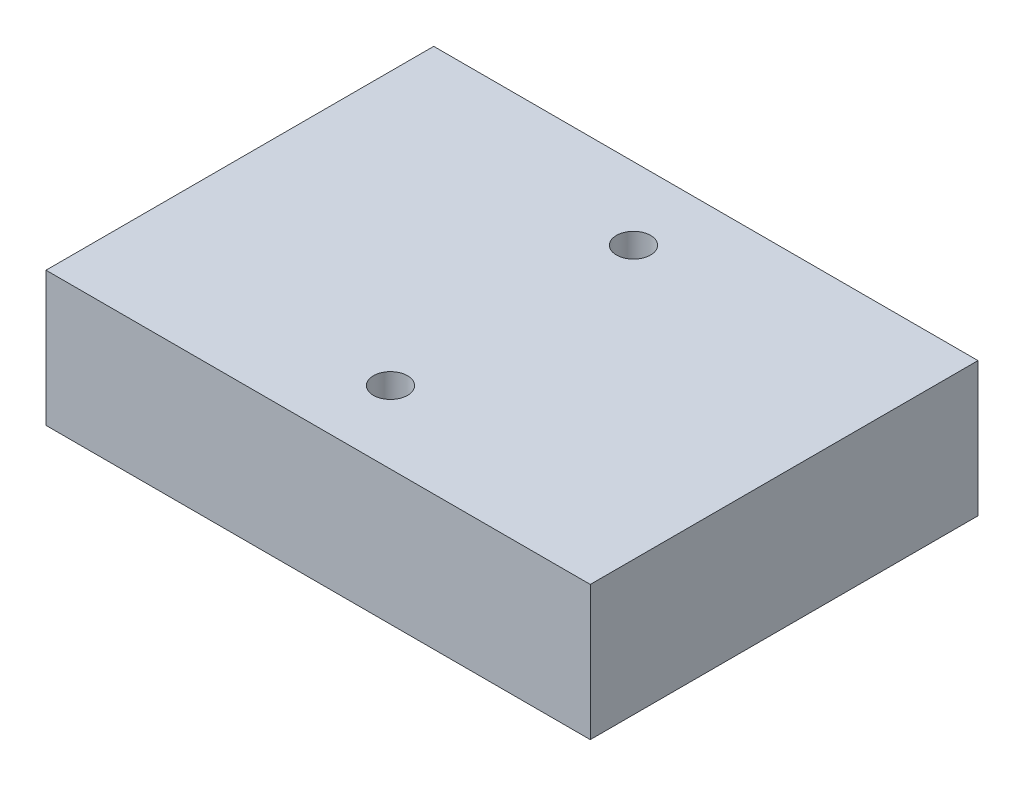
from build123d import *

# Parameters (mm, degrees)
SKETCH1_W           = 52.63
SKETCH1_H           = 37.49
BOSS_EXTRUDE1_DEPTH = 13
SKETCH2_R           = 1.65
CUT_EXTRUDE1_DEPTH  = 35.826057055


with BuildPart() as part:
    # Sketch1 → Boss-Extrude1 (new body)
    with BuildSketch(Plane(origin=(0, 0, 0), x_dir=(1, 0, 0), z_dir=(0, 1, 0))):
        Rectangle(SKETCH1_W, SKETCH1_H)
    extrude(amount=BOSS_EXTRUDE1_DEPTH)

    # Sketch2 → Cut-Extrude1 (cut, through all)
    with BuildSketch(Plane(origin=(0, 13, 0), x_dir=(1, 0, 0), z_dir=(0, 1, 0))):
        with Locations((0, 11.75)):
            Circle(SKETCH2_R)
        with Locations((0, -11.75)):
            Circle(SKETCH2_R)
    extrude(amount=-CUT_EXTRUDE1_DEPTH, mode=Mode.SUBTRACT)


solid = part.part
